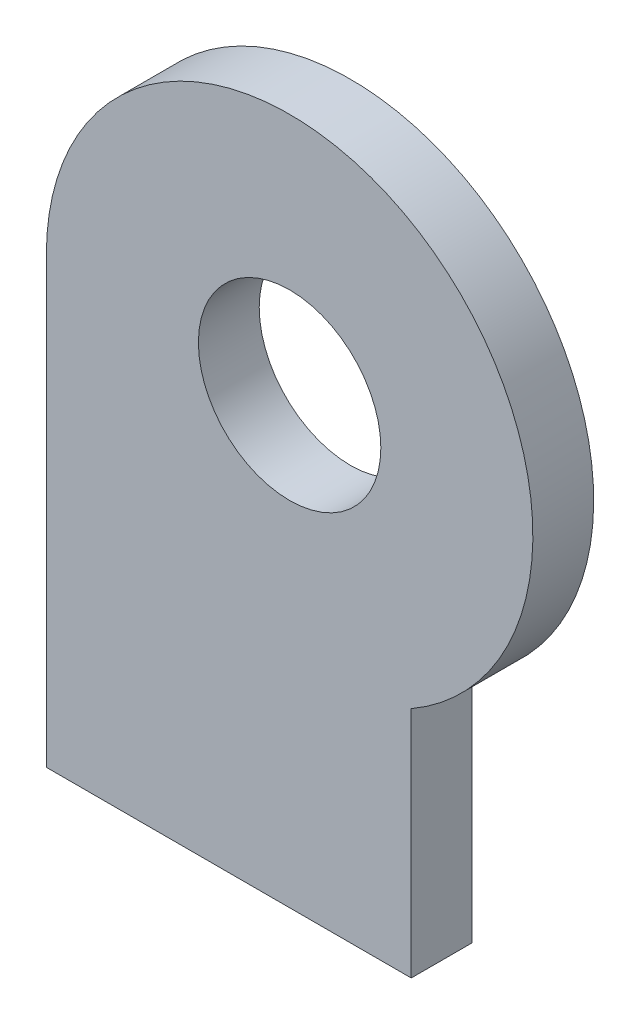
from build123d import *

# Parameters (mm, degrees)
SKETCH1_R           = 4.7625
BOSS_EXTRUDE1_DEPTH = 3.175


with BuildPart() as part:
    # Sketch1 → Boss-Extrude1 (new body)
    with BuildSketch(Plane.XY):
        with BuildLine():
            Line((7.987675642, 20.35683), (7.987675642, -2.82067))
            Line((7.987675642, -2.82067), (27.037675642, -2.82067))
            Line((27.037675642, -2.82067), (27.037675642, 9.358307372))
            ThreePointArc((27.037675642, 9.358307372), (27.037675642, 31.355352628), (7.987675642, 20.35683))
        make_face()
        with Locations((20.687675642, 20.35683)):
            Circle(SKETCH1_R, mode=Mode.SUBTRACT)
    extrude(amount=BOSS_EXTRUDE1_DEPTH)


solid = part.part
